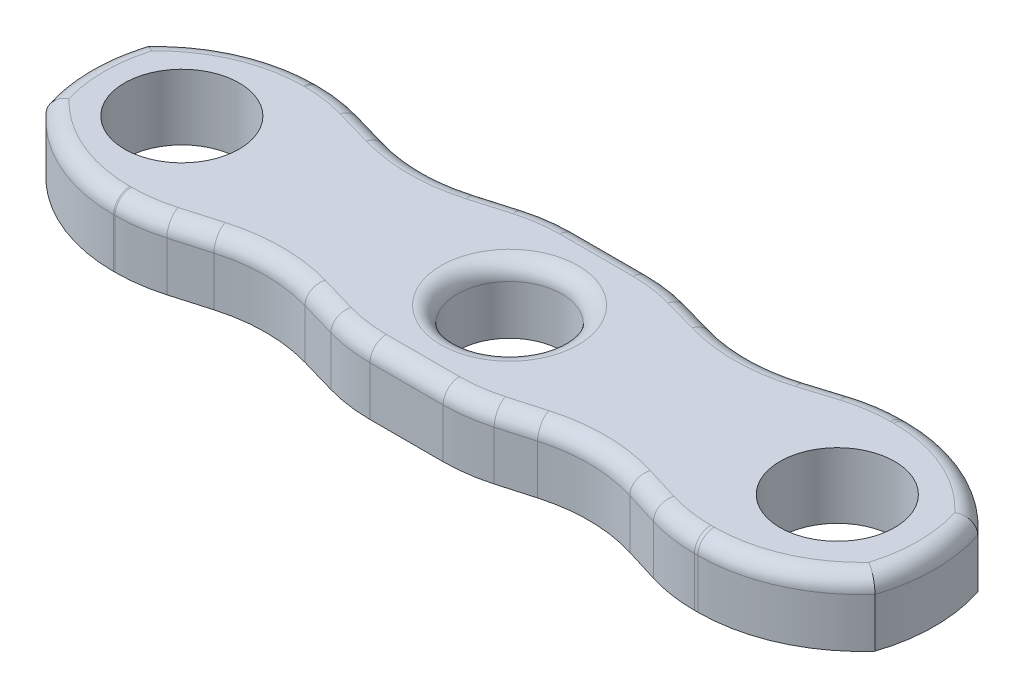
from build123d import *

# Parameters (mm, degrees)
BOSS_EXTRUDE3_DEPTH = 2.54
FILLET1_R           = 6.35
FILLET2_R           = 0.635


with BuildPart() as part:
    # Sketch2 → Boss-Extrude3 (new body)
    with BuildSketch(Plane(origin=(0, 0, 0), x_dir=(1, 0, 0), z_dir=(0, 1, 0))):
        with BuildLine():
            ThreePointArc((-14.9225, 0), (-12.7, 2.2225), (-10.4775, 0))
            Line((-10.4775, 0), (-8.081142289, 0))
            Line((-8.081142289, 0), (-9.450372471, 2.371576242))
            Line((-9.450372471, 2.371576242), (-10.390571145, 4.000048114))
            Line((-10.390571145, 4.000048114), (-15.009428855, 4.000048114))
            Line((-15.009428855, 4.000048114), (-17.318857711, 0))
            Line((-17.318857711, 0), (-14.9225, 0))
        make_face()
        with BuildLine():
            Line((-8.081142289, 0), (-10.4775, 0))
            ThreePointArc((-10.4775, 0), (-12.7, -2.2225), (-14.9225, 0))
            Line((-14.9225, 0), (-17.318857711, 0))
            Line((-17.318857711, 0), (-15.009428855, -4.000048114))
            Line((-15.009428855, -4.000048114), (-10.390571145, -4.000048114))
            Line((-10.390571145, -4.000048114), (-9.235856717, -2.000024057))
            Line((-9.235856717, -2.000024057), (-8.081142289, 0))
        make_face()
        Polygon((-9.450372471, 2.371576242), (-8.081142289, 0), (-4.618857711, 0), (-3.464143283, 2.000024057), (-2.309428855, 4.000048114), (-6.35, 2.833322689), (-10.390571145, 4.000048114), align=None)
        Polygon((-4.618857711, 0), (-8.081142289, 0), (-9.235856717, -2.000024057), (-10.390571145, -4.000048114), (-6.35, -2.833322689), (-2.309428855, -4.000048114), (-3.464143283, -2.000024057), align=None)
        with BuildLine():
            Line((-3.464143283, 2.000024057), (-4.618857711, 0))
            Line((-4.618857711, 0), (-2.025, 0))
            ThreePointArc((-2.025, 0), (0, 2.025), (2.025, 0))
            Line((2.025, 0), (4.618857711, 0))
            Line((4.618857711, 0), (3.464143283, 2.000024057))
            Line((3.464143283, 2.000024057), (2.309428855, 4.000048114))
            Line((2.309428855, 4.000048114), (-2.309428855, 4.000048114))
            Line((-2.309428855, 4.000048114), (-3.464143283, 2.000024057))
        make_face()
        with BuildLine():
            Line((-2.025, 0), (-4.618857711, 0))
            Line((-4.618857711, 0), (-3.464143283, -2.000024057))
            Line((-3.464143283, -2.000024057), (-2.309428855, -4.000048114))
            Line((-2.309428855, -4.000048114), (2.309428855, -4.000048114))
            Line((2.309428855, -4.000048114), (3.464143283, -2.000024057))
            Line((3.464143283, -2.000024057), (4.618857711, 0))
            Line((4.618857711, 0), (2.025, 0))
            ThreePointArc((2.025, 0), (0, -2.025), (-2.025, 0))
        make_face()
        Polygon((3.464143283, 2.000024057), (4.618857711, 0), (7.946932116, 0), (9.135199087, 2.058138767), (10.323466058, 4.116277534), (6.282791089, 2.86963953), (2.309428855, 4.000048114), align=None)
        Polygon((7.946932116, 0), (4.618857711, 0), (3.464143283, -2.000024057), (2.309428855, -4.000048114), (6.282791089, -2.86963953), (10.323466058, -4.116277534), (9.135199087, -2.058138767), align=None)
        with BuildLine():
            Line((9.135199087, 2.058138767), (7.946932116, 0))
            Line((7.946932116, 0), (10.4775, 0))
            ThreePointArc((10.4775, 0), (12.7, 2.2225), (14.9225, 0))
            Line((14.9225, 0), (17.453067884, 0))
            Line((17.453067884, 0), (15.076533942, 4.116277534))
            Line((15.076533942, 4.116277534), (10.323466058, 4.116277534))
            Line((10.323466058, 4.116277534), (9.135199087, 2.058138767))
        make_face()
        with BuildLine():
            Line((10.4775, 0), (7.946932116, 0))
            Line((7.946932116, 0), (9.135199087, -2.058138767))
            Line((9.135199087, -2.058138767), (10.323466058, -4.116277534))
            Line((10.323466058, -4.116277534), (15.076533942, -4.116277534))
            Line((15.076533942, -4.116277534), (17.453067884, 0))
            Line((17.453067884, 0), (14.9225, 0))
            ThreePointArc((14.9225, 0), (12.7, -2.2225), (10.4775, 0))
        make_face()
    extrude(amount=BOSS_EXTRUDE3_DEPTH)

    # Fillet1
    # the kernel refuses this fillet: 6.35 mm, written as the material it adds along each edge
    with BuildSketch(Plane(origin=(-6.35, 0, -2.833322689), x_dir=(-0.9607490883142406, 0, -0.2774187976748433), z_dir=(0, 1, 0)), Plane(origin=(-6.35, 0, 2.833322689), x_dir=(0.9607490883142819, 0, 0.27741879767470035), z_dir=(0, 1, 0))) as fillet1_piece_1:
        with BuildLine():
            CenterArc((FILLET1_R * 0.288752600496, -FILLET1_R), FILLET1_R, 90, 32.212421432)
            Line((-FILLET1_R * 0.244307113399, -FILLET1_R * 0.153922378607), (0, 0))
            Line((0, 0), (FILLET1_R * 0.288752600496, 0))
        make_face()
    extrude(amount=2.54)
    with BuildSketch(Plane(origin=(6.282791089, 0, -2.86963953), x_dir=(-0.9618326798752038, 0, -0.27363825742041953), z_dir=(0, 1, 0)), Plane(origin=(6.282791089, 0, 2.86963953), x_dir=(0.9555558296704232, 0, 0.2948102040005893), z_dir=(0, 1, 0))) as fillet1_piece_2:
        with BuildLine():
            CenterArc((FILLET1_R * 0.296470151245, -FILLET1_R), FILLET1_R, 90, 33.027036352)
            Line((-FILLET1_R * 0.248564569422, -FILLET1_R * 0.16158652607), (0, 0))
            Line((0, 0), (FILLET1_R * 0.296470151245, 0))
        make_face()
    extrude(amount=2.54)
    # the kernel refuses this fillet: 6.35 mm, written as the material it takes off along each edge
    with BuildSketch(Plane(origin=(-10.390571145, -2.246092292, -4.000048114), x_dir=(-1, 0, 0), z_dir=(0, 1, 0))) as fillet1_2_piece_1:
        with BuildLine():
            CenterArc((FILLET1_R * 0.141486128607, FILLET1_R), FILLET1_R, 253.893789284, 16.106210716)
            Line((-FILLET1_R * 0.135932669068, FILLET1_R * 0.0392509116858), (0, 0))
            Line((0, 0), (FILLET1_R * 0.141486128607, 0))
        make_face()
    extrude(amount=7.032184583, mode=Mode.SUBTRACT)
    with BuildSketch(Plane(origin=(-2.309428855, -2.246092292, -4.000048114), x_dir=(1, 0, 0), z_dir=(0, 1, 0)), Plane(origin=(-2.309428855, -2.246092292, 4.000048114), x_dir=(-0.9607490883142817, 0, -0.2774187976747005), z_dir=(0, 1, 0)), Plane(origin=(-10.390571145, -2.246092292, 4.000048114), x_dir=(-1, 0, 0), z_dir=(0, 1, 0))) as fillet1_2_piece_2:
        with BuildLine():
            CenterArc((FILLET1_R * 0.141486128607, -FILLET1_R), FILLET1_R, 90, 16.106210716)
            Line((-FILLET1_R * 0.135932669068, -FILLET1_R * 0.0392509116857), (0, 0))
            Line((0, 0), (FILLET1_R * 0.141486128607, 0))
        make_face()
    extrude(amount=7.032184583, mode=Mode.SUBTRACT)
    with BuildSketch(Plane(origin=(2.309428855, -2.214259851, -4.000048114), x_dir=(0.9618326798752038, 0, 0.27363825742041936), z_dir=(0, 1, 0)), Plane(origin=(2.309428855, -2.214259851, 4.000048114), x_dir=(-1, 0, 0), z_dir=(0, 1, 0))) as fillet1_2_piece_3:
        with BuildLine():
            CenterArc((FILLET1_R * 0.139480935468, -FILLET1_R), FILLET1_R, 90, 15.880879627)
            Line((-FILLET1_R * 0.134157321953, -FILLET1_R * 0.0381673201248), (0, 0))
            Line((0, 0), (FILLET1_R * 0.139480935468, 0))
        make_face()
    extrude(amount=6.968519701, mode=Mode.SUBTRACT)
    with BuildSketch(Plane(origin=(10.323466058, -2.39323875, -4.116277534), x_dir=(1, 0, 0), z_dir=(0, 1, 0)), Plane(origin=(10.323466058, -2.39323875, 4.116277534), x_dir=(-0.9555558296704234, 0, -0.294810204000589), z_dir=(0, 1, 0))) as fillet1_2_piece_4:
        with BuildLine():
            CenterArc((FILLET1_R * 0.150755196823, -FILLET1_R), FILLET1_R, 90, 17.146156725)
            Line((-FILLET1_R * 0.144055007178, -FILLET1_R * 0.0444441703296), (0, 0))
            Line((0, 0), (FILLET1_R * 0.150755196823, 0))
        make_face()
    extrude(amount=7.326477499, mode=Mode.SUBTRACT)
    with BuildSketch(Plane(origin=(15.076533942, -9.165435523, -4.116277534), x_dir=(0.500000000000005, 0, 0.8660254037844358), z_dir=(0, 1, 0)), Plane(origin=(17.453067884, -9.165435523, 0), x_dir=(-0.49999999999999534, 0, 0.8660254037844413), z_dir=(0, 1, 0)), Plane(origin=(15.076533942, -9.165435523, 4.116277534), x_dir=(-1, 0, 0), z_dir=(0, 1, 0)), Plane(origin=(-15.009428855, -9.165435523, 4.000048114), x_dir=(-0.5000000000000033, 0, -0.8660254037844367), z_dir=(0, 1, 0)), Plane(origin=(-17.318857711, -9.165435523, 0), x_dir=(0.4999999999999972, 0, -0.8660254037844403), z_dir=(0, 1, 0)), Plane(origin=(-15.009428855, -9.165435523, -4.000048114), x_dir=(1, 0, 0), z_dir=(0, 1, 0))) as fillet1_2_piece_5:
        with BuildLine():
            CenterArc((FILLET1_R * 0.57735026919, -FILLET1_R), FILLET1_R, 90, 60)
            Line((-FILLET1_R * 0.288675134595, -FILLET1_R * 0.5), (0, 0))
            Line((0, 0), (FILLET1_R * 0.57735026919, 0))
        make_face()
    extrude(amount=20.870871047, mode=Mode.SUBTRACT)

    # Fillet2
    fillet2_edges = [part.edges().sort_by_distance(p)[0] for p in [
        (-2.025, 2.54, 0),
        (-8.819504031, 2.54, -3.546398399),
        (8.745211682, 2.54, 3.629350993),
        (11.345560645, 2.54, 4.116277534),
        (11.345560645, 2.54, -4.116277534),
        (8.745211682, 2.54, -3.629350993),
        (3.81669336, 2.54, -3.571236283),
        (0.006366488, 2.54, -4.000048114),
        (-3.880495969, 2.54, -3.546398399),
        (-11.316131354, 2.54, 4.000048114),
        (-8.819504031, 2.54, 3.546398399),
        (-3.880495969, 2.54, 3.546398399),
        (0.006366488, 2.54, 4.000048114),
        (3.81669336, 2.54, 3.571236283),
        (-13.908962899, 2.54, -3.458631518),
        (-16.336509292, 2.54, 0),
        (-13.908962899, 2.54, 3.458631518),
        (-10.399430946, 2.54, 3.937428535),
        (-2.300569054, 2.54, 3.937428535),
        (2.30093691, 2.54, 3.939165629),
        (10.334162366, 2.54, 4.045326026),
        (14.007411183, 2.54, 3.560915034),
        (16.470719465, 2.54, 0),
        (14.007411183, 2.54, -3.560915034),
        (10.334162366, 2.54, -4.045326026),
        (2.30093691, 2.54, -3.939165629),
        (-2.300569054, 2.54, -3.937428535),
        (-10.399430946, 2.54, -3.937428535),
        (-6.35, 2.54, -3.092748685),
        (6.279774704, 2.54, -3.142811536),
        (6.279774704, 2.54, 3.142811536),
        (-6.35, 2.54, 3.092748685),
        (-11.316131354, 2.54, -4.000048114),
    ]]
    fillet(fillet2_edges, radius=FILLET2_R)


solid = part.part
